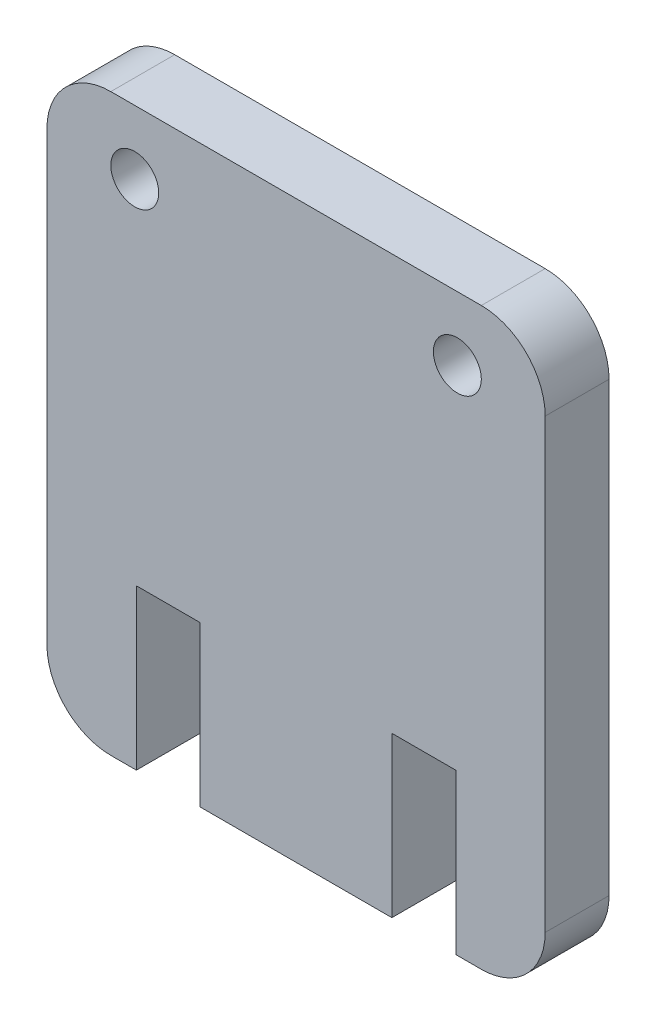
from build123d import *

# Parameters (mm, degrees)
MODEL_R             = 0.75
BOSS_EXTRUDE1_DEPTH = 2


with BuildPart() as part:
    # Model → Boss-Extrude1 (new body)
    with BuildSketch(Plane.XY):
        with BuildLine():
            Line((2, 0), (2.8, 0))
            Line((2.8, 0), (2.8, 5))
            Line((2.8, 5), (4.8, 5))
            Line((4.8, 5), (4.8, 0))
            Line((4.8, 0), (10.8, 0))
            Line((10.8, 0), (10.8, 5))
            Line((10.8, 5), (12.8, 5))
            Line((12.8, 5), (12.8, 0))
            Line((12.8, 0), (13.6, 0))
            ThreePointArc((13.6, 0), (15.014213562, 0.585786438), (15.6, 2))
            Line((15.6, 2), (15.6, 16))
            ThreePointArc((15.6, 16), (15.014213562, 17.414213562), (13.6, 18))
            Line((13.6, 18), (2, 18))
            ThreePointArc((2, 18), (0.585786438, 17.414213562), (0, 16))
            Line((0, 16), (0, 2))
            ThreePointArc((0, 2), (0.585786438, 0.585786438), (2, 0))
        make_face()
        with Locations((2.75, 16)):
            Circle(MODEL_R, mode=Mode.SUBTRACT)
        with Locations((12.85, 16)):
            Circle(MODEL_R, mode=Mode.SUBTRACT)
    extrude(amount=BOSS_EXTRUDE1_DEPTH)


solid = part.part
